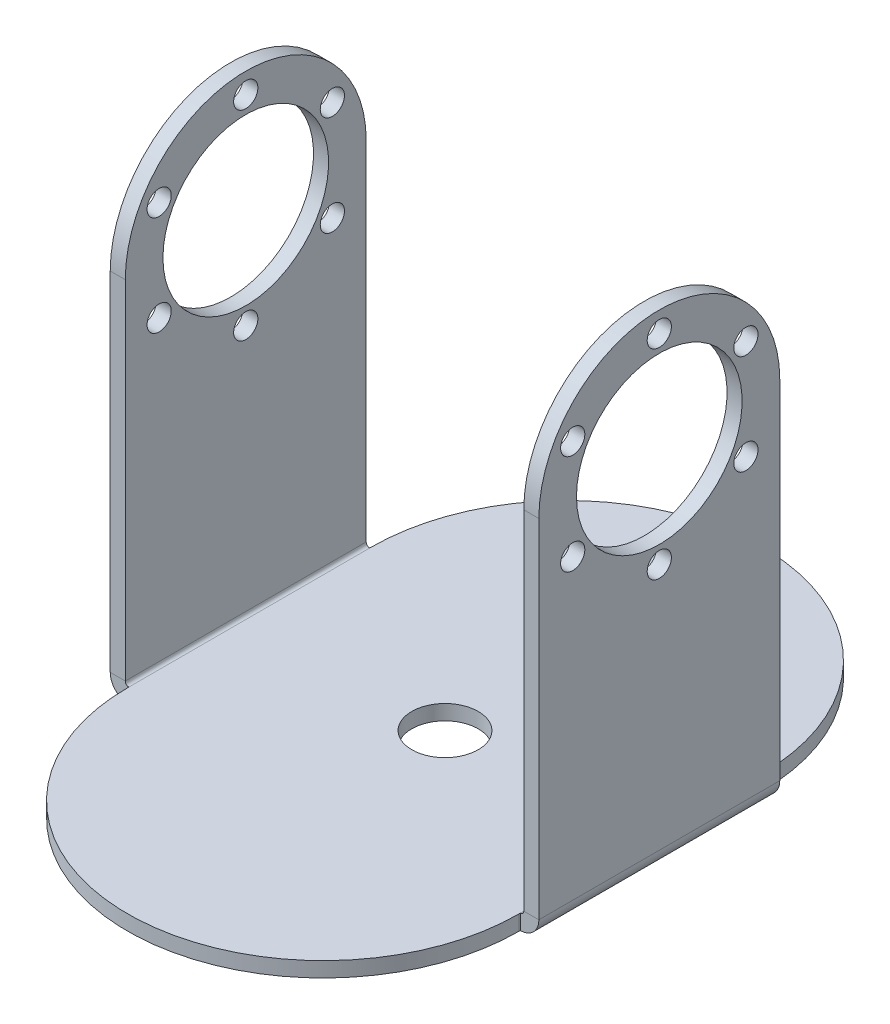
from build123d import *

# Parameters (mm, degrees)
BOSS_EXTRUDE1_DEPTH             = 3.175
SKETCH2_R                       = 17.4625
CUT_EXTRUDE1_DEPTH              = 171.897583858
F_10_CLEARANCE_HOLE1_AT_2_COUNT = 2
F_10_CLEARANCE_HOLE1_AT_2_PITCH = 21.082
F_10_CLEARANCE_HOLE1_AT_3_COUNT = 2
F_10_CLEARANCE_HOLE1_AT_3_PITCH = 36.515095125
F_10_CLEARANCE_HOLE1_AT_4_COUNT = 2
F_10_CLEARANCE_HOLE1_AT_4_PITCH = 42.164
F_10_CLEARANCE_HOLE1_AT_5_COUNT = 2
F_10_CLEARANCE_HOLE1_AT_5_PITCH = 36.515095125
F_10_CLEARANCE_HOLE1_AT_6_COUNT = 2
F_10_CLEARANCE_HOLE1_AT_6_PITCH = 21.082
SKETCHED_START                  = -145
SKETCHED_BEND1_OUTLINE_W        = 3.175
SKETCHED_BEND1_OUTLINE_H        = 50.8
SKETCHED_BEND1_DEPTH            = 99.8134
SKETCHED_START_2                = 45.1866
SKETCHED_BEND1_2_OUTLINE_W      = 3.175
SKETCHED_BEND1_2_OUTLINE_H      = 50.8
SKETCHED_BEND1_2_DEPTH          = 99.8134
SKETCHED_START_3                = -44.806157784
SKETCHED_BEND1_3_OUTLINE_R      = 2.5527
SKETCHED_BEND1_3_OUTLINE_R_2    = 17.4625
SKETCHED_BEND1_3_DEPTH          = 2.794557784
SKETCHED_START_4                = 42.0116
SKETCHED_BEND1_4_OUTLINE_R      = 2.5527
SKETCHED_BEND1_4_OUTLINE_R_2    = 17.4625
SKETCHED_BEND1_4_DEPTH          = 2.794557784
SKETCHED_START_5                = -45.1866
SKETCHED_BEND1_5_OUTLINE_R      = 2.5527
SKETCHED_BEND1_5_OUTLINE_R_2    = 17.4625
SKETCHED_BEND1_5_DEPTH          = 3.9116
SKETCHED_START_6                = 41.275
SKETCHED_BEND1_6_OUTLINE_R      = 2.5527
SKETCHED_BEND1_6_OUTLINE_R_2    = 17.4625
SKETCHED_BEND1_6_DEPTH          = 3.9116
SKETCHED_START_7                = -51.054
SKETCHED_BEND1_7_DEPTH          = 50.8
SKETCH7_R                       = 7
CUT_EXTRUDE2_DEPTH              = 144.172192314


with BuildPart() as part:
    # Sketch1 → Boss-Extrude1 (new body)
    with BuildSketch(Plane(origin=(0, 0, 0), x_dir=(1, 0, 0), z_dir=(0, 1, 0))):
        with BuildLine():
            Line((-41.275, 0), (-41.275, 0.254))
            Line((-41.275, 0.254), (-118.2116, 0.254))
            ThreePointArc((-118.2116, 0.254), (-143.6116, 25.654), (-118.2116, 51.054))
            Line((-118.2116, 51.054), (-41.275, 51.054))
            Line((-41.275, 51.054), (-41.275, 51.308))
            ThreePointArc((-41.275, 51.308), (0, 92.583), (41.275, 51.308))
            Line((41.275, 51.308), (41.275, 51.054))
            Line((41.275, 51.054), (118.2116, 51.054))
            ThreePointArc((118.2116, 51.054), (143.6116, 25.654), (118.2116, 0.254))
            Line((118.2116, 0.254), (41.275, 0.254))
            Line((41.275, 0.254), (41.275, 0))
            ThreePointArc((41.275, 0), (0, -41.275), (-41.275, 0))
        make_face()
    extrude(amount=BOSS_EXTRUDE1_DEPTH)

    # Sketch2 → Cut-Extrude1 (cut, through all)
    with BuildSketch(Plane(origin=(0, 3.175, 0), x_dir=(1, 0, 0), z_dir=(0, 1, 0))):
        with Locations(Location((-118.2116, 25.654, 0), (0, 0, 270))):
            Circle(SKETCH2_R)
    cut_extrude1 = extrude(amount=-CUT_EXTRUDE1_DEPTH, mode=Mode.SUBTRACT)

    # Sketch5 → #10 Clearance Hole1 (revolve, cut)
    with BuildSketch(Plane(origin=(-97.1296, 3.175, -25.654), x_dir=(0, 0, 1), z_dir=(1, 0, 0))):
        Polygon((0, 0), (0, 39.633816902), (2.5527, 38.1), (2.5527, 0), align=None)
    f_10_clearance_hole1 = revolve(axis=Axis((-97.1296, 9.525, -25.654), (0, -1, 0)), mode=Mode.SUBTRACT)

    # #10 Clearance Hole1 at 2: #10 Clearance Hole1 ×2
    with Locations(*[Vector(-0.5000000000000003, 0, -0.8660254037844385) * (i * F_10_CLEARANCE_HOLE1_AT_2_PITCH) for i in range(1, F_10_CLEARANCE_HOLE1_AT_2_COUNT)]):
        add(f_10_clearance_hole1, mode=Mode.SUBTRACT)

    # #10 Clearance Hole1 at 3: #10 Clearance Hole1 ×2
    with Locations(*[Vector(-0.8660254037844388, 0, -0.4999999999999998) * (i * F_10_CLEARANCE_HOLE1_AT_3_PITCH) for i in range(1, F_10_CLEARANCE_HOLE1_AT_3_COUNT)]):
        add(f_10_clearance_hole1, mode=Mode.SUBTRACT)

    # #10 Clearance Hole1 at 4: #10 Clearance Hole1 ×2
    with Locations(*[(-i * F_10_CLEARANCE_HOLE1_AT_4_PITCH, 0, 0) for i in range(1, F_10_CLEARANCE_HOLE1_AT_4_COUNT)]):
        add(f_10_clearance_hole1, mode=Mode.SUBTRACT)

    # #10 Clearance Hole1 at 5: #10 Clearance Hole1 ×2
    with Locations(*[Vector(-0.8660254037844386, 0, 0.5000000000000002) * (i * F_10_CLEARANCE_HOLE1_AT_5_PITCH) for i in range(1, F_10_CLEARANCE_HOLE1_AT_5_COUNT)]):
        add(f_10_clearance_hole1, mode=Mode.SUBTRACT)

    # #10 Clearance Hole1 at 6: #10 Clearance Hole1 ×2
    with Locations(*[Vector(-0.5000000000000003, 0, 0.8660254037844385) * (i * F_10_CLEARANCE_HOLE1_AT_6_PITCH) for i in range(1, F_10_CLEARANCE_HOLE1_AT_6_COUNT)]):
        add(f_10_clearance_hole1, mode=Mode.SUBTRACT)

    # Mirror1: Cut-Extrude1, #10 Clearance Hole1 across plane
    add(cut_extrude1.mirror(Plane(origin=(0, 0, 0), x_dir=(0, 0, 1), z_dir=(1, 0, 0))), mode=Mode.SUBTRACT)
    add(f_10_clearance_hole1.mirror(Plane(origin=(0, 0, 0), x_dir=(0, 0, 1), z_dir=(1, 0, 0))), mode=Mode.SUBTRACT)

    # Mirror1 copy 1 sketch → Mirror1 copy 1 (revolve, cut)
    with BuildSketch(Plane(origin=(107.6706, 3.175, -43.911547563), x_dir=(0, 0, 1), z_dir=(-1, 0, 0))):
        Polygon((0, 0), (0, -39.633816902), (2.5527, -38.1), (2.5527, 0), align=None)
    revolve(axis=Axis((107.6706, 9.525, -43.911547563), (0, 1, 0)), mode=Mode.SUBTRACT)

    # Mirror1 copy 2 sketch → Mirror1 copy 2 (revolve, cut)
    with BuildSketch(Plane(origin=(128.7526, 3.175, -43.911547563), x_dir=(0, 0, 1), z_dir=(-1, 0, 0))):
        Polygon((0, 0), (0, -39.633816902), (2.5527, -38.1), (2.5527, 0), align=None)
    revolve(axis=Axis((128.7526, 9.525, -43.911547563), (0, 1, 0)), mode=Mode.SUBTRACT)

    # Mirror1 copy 3 sketch → Mirror1 copy 3 (revolve, cut)
    with BuildSketch(Plane(origin=(139.2936, 3.175, -25.654), x_dir=(0, 0, 1), z_dir=(-1, 0, 0))):
        Polygon((0, 0), (0, -39.633816902), (2.5527, -38.1), (2.5527, 0), align=None)
    revolve(axis=Axis((139.2936, 9.525, -25.654), (0, 1, 0)), mode=Mode.SUBTRACT)

    # Mirror1 copy 4 sketch → Mirror1 copy 4 (revolve, cut)
    with BuildSketch(Plane(origin=(128.7526, 3.175, -7.396452437), x_dir=(0, 0, 1), z_dir=(-1, 0, 0))):
        Polygon((0, 0), (0, -39.633816902), (2.5527, -38.1), (2.5527, 0), align=None)
    revolve(axis=Axis((128.7526, 9.525, -7.396452437), (0, 1, 0)), mode=Mode.SUBTRACT)

    # Mirror1 copy 5 sketch → Mirror1 copy 5 (revolve, cut)
    with BuildSketch(Plane(origin=(107.6706, 3.175, -7.396452437), x_dir=(0, 0, 1), z_dir=(-1, 0, 0))):
        Polygon((0, 0), (0, -39.633816902), (2.5527, -38.1), (2.5527, 0), align=None)
    revolve(axis=Axis((107.6706, 9.525, -7.396452437), (0, 1, 0)), mode=Mode.SUBTRACT)

    # Sketched Bend1: read off the stored shape, not the designer's step
    # Sketched Bend1 outline → Sketched Bend1 (cut)
    with BuildSketch(Plane.YZ.offset(SKETCHED_START)):
        with Locations((1.5875, -25.654)):
            Rectangle(SKETCHED_BEND1_OUTLINE_W, SKETCHED_BEND1_OUTLINE_H)
    extrude(amount=SKETCHED_BEND1_DEPTH, mode=Mode.SUBTRACT)

    # Sketched Bend1 2 outline → Sketched Bend1 2 (cut)
    with BuildSketch(Plane.YZ.offset(SKETCHED_START_2)):
        with Locations((1.5875, -25.654)):
            Rectangle(SKETCHED_BEND1_2_OUTLINE_W, SKETCHED_BEND1_2_OUTLINE_H)
    extrude(amount=SKETCHED_BEND1_2_DEPTH, mode=Mode.SUBTRACT)

    # Sketched Bend1 3 outline → Sketched Bend1 3 (add)
    with BuildSketch(Plane.YZ.offset(SKETCHED_START_3)):
        with BuildLine():
            Line((77.197512257, -0.254), (3.175, -0.254))
            Line((3.175, -0.254), (3.175, -51.054))
            Line((3.175, -51.054), (77.197512257, -51.054))
            ThreePointArc((77.197512257, -51.054), (102.597512257, -25.654), (77.197512257, -0.254))
        make_face()
        with Locations((66.656512257, -43.911547563)):
            Circle(SKETCHED_BEND1_3_OUTLINE_R, mode=Mode.SUBTRACT)
        with Locations((87.738512257, -43.911547563)):
            Circle(SKETCHED_BEND1_3_OUTLINE_R, mode=Mode.SUBTRACT)
        with Locations((56.115512257, -25.654)):
            Circle(SKETCHED_BEND1_3_OUTLINE_R, mode=Mode.SUBTRACT)
        with Locations((77.197512257, -25.654)):
            Circle(SKETCHED_BEND1_3_OUTLINE_R_2, mode=Mode.SUBTRACT)
        with Locations((98.279512257, -25.654)):
            Circle(SKETCHED_BEND1_3_OUTLINE_R, mode=Mode.SUBTRACT)
        with Locations((66.656512257, -7.396452437)):
            Circle(SKETCHED_BEND1_3_OUTLINE_R, mode=Mode.SUBTRACT)
        with Locations((87.738512257, -7.396452437)):
            Circle(SKETCHED_BEND1_3_OUTLINE_R, mode=Mode.SUBTRACT)
    extrude(amount=SKETCHED_BEND1_3_DEPTH)

    # Sketched Bend1 4 outline → Sketched Bend1 4 (add)
    with BuildSketch(Plane.YZ.offset(SKETCHED_START_4)):
        with BuildLine():
            Line((77.197512257, -0.254), (3.175, -0.254))
            Line((3.175, -0.254), (3.175, -51.054))
            Line((3.175, -51.054), (77.197512257, -51.054))
            ThreePointArc((77.197512257, -51.054), (102.597512257, -25.654), (77.197512257, -0.254))
        make_face()
        with Locations((66.656512257, -43.911547563)):
            Circle(SKETCHED_BEND1_4_OUTLINE_R, mode=Mode.SUBTRACT)
        with Locations((87.738512257, -43.911547563)):
            Circle(SKETCHED_BEND1_4_OUTLINE_R, mode=Mode.SUBTRACT)
        with Locations((56.115512257, -25.654)):
            Circle(SKETCHED_BEND1_4_OUTLINE_R, mode=Mode.SUBTRACT)
        with Locations((77.197512257, -25.654)):
            Circle(SKETCHED_BEND1_4_OUTLINE_R_2, mode=Mode.SUBTRACT)
        with Locations((98.279512257, -25.654)):
            Circle(SKETCHED_BEND1_4_OUTLINE_R, mode=Mode.SUBTRACT)
        with Locations((66.656512257, -7.396452437)):
            Circle(SKETCHED_BEND1_4_OUTLINE_R, mode=Mode.SUBTRACT)
        with Locations((87.738512257, -7.396452437)):
            Circle(SKETCHED_BEND1_4_OUTLINE_R, mode=Mode.SUBTRACT)
    extrude(amount=SKETCHED_BEND1_4_DEPTH)

    # Sketched Bend1 5 outline → Sketched Bend1 5 (add)
    with BuildSketch(Plane.YZ.offset(SKETCHED_START_5)):
        with BuildLine():
            Line((77.197512257, -0.254), (3.175, -0.254))
            Line((3.175, -0.254), (3.175, -51.054))
            Line((3.175, -51.054), (77.197512257, -51.054))
            ThreePointArc((77.197512257, -51.054), (102.597512257, -25.654), (77.197512257, -0.254))
        make_face()
        with Locations((66.656512257, -43.911547563)):
            Circle(SKETCHED_BEND1_5_OUTLINE_R, mode=Mode.SUBTRACT)
        with Locations((87.738512257, -43.911547563)):
            Circle(SKETCHED_BEND1_5_OUTLINE_R, mode=Mode.SUBTRACT)
        with Locations((56.115512257, -25.654)):
            Circle(SKETCHED_BEND1_5_OUTLINE_R, mode=Mode.SUBTRACT)
        with Locations((77.197512257, -25.654)):
            Circle(SKETCHED_BEND1_5_OUTLINE_R_2, mode=Mode.SUBTRACT)
        with Locations((98.279512257, -25.654)):
            Circle(SKETCHED_BEND1_5_OUTLINE_R, mode=Mode.SUBTRACT)
        with Locations((66.656512257, -7.396452437)):
            Circle(SKETCHED_BEND1_5_OUTLINE_R, mode=Mode.SUBTRACT)
        with Locations((87.738512257, -7.396452437)):
            Circle(SKETCHED_BEND1_5_OUTLINE_R, mode=Mode.SUBTRACT)
    extrude(amount=SKETCHED_BEND1_5_DEPTH)

    # Sketched Bend1 6 outline → Sketched Bend1 6 (add)
    with BuildSketch(Plane.YZ.offset(SKETCHED_START_6)):
        with BuildLine():
            Line((77.197512257, -0.254), (3.175, -0.254))
            Line((3.175, -0.254), (3.175, -51.054))
            Line((3.175, -51.054), (77.197512257, -51.054))
            ThreePointArc((77.197512257, -51.054), (102.597512257, -25.654), (77.197512257, -0.254))
        make_face()
        with Locations((66.656512257, -43.911547563)):
            Circle(SKETCHED_BEND1_6_OUTLINE_R, mode=Mode.SUBTRACT)
        with Locations((87.738512257, -43.911547563)):
            Circle(SKETCHED_BEND1_6_OUTLINE_R, mode=Mode.SUBTRACT)
        with Locations((56.115512257, -25.654)):
            Circle(SKETCHED_BEND1_6_OUTLINE_R, mode=Mode.SUBTRACT)
        with Locations((77.197512257, -25.654)):
            Circle(SKETCHED_BEND1_6_OUTLINE_R_2, mode=Mode.SUBTRACT)
        with Locations((98.279512257, -25.654)):
            Circle(SKETCHED_BEND1_6_OUTLINE_R, mode=Mode.SUBTRACT)
        with Locations((66.656512257, -7.396452437)):
            Circle(SKETCHED_BEND1_6_OUTLINE_R, mode=Mode.SUBTRACT)
        with Locations((87.738512257, -7.396452437)):
            Circle(SKETCHED_BEND1_6_OUTLINE_R, mode=Mode.SUBTRACT)
    extrude(amount=SKETCHED_BEND1_6_DEPTH)

    # Sketched Bend1 7 outline → Sketched Bend1 7 (cut)
    with BuildSketch(Plane.XY.offset(SKETCHED_START_7)):
        with BuildLine():
            Line((-42.0116, 104), (-42.0116, 3.9116))
            ThreePointArc((-42.0116, 3.9116), (-41.795854855, 3.390745145), (-41.275, 3.175))
            Line((-41.275, 3.175), (-41.275, 104))
            Line((-41.275, 104), (-42.0116, 104))
        make_face()
        with BuildLine():
            Line((-45.1866, 3.9116), (-45.186600025, 104))
            Line((-45.186600025, 104), (-47, 104))
            Line((-47, 104), (-47, -2.2e-08))
            Line((-47, -2.2e-08), (-41.275, 0))
            ThreePointArc((-41.275, 0), (-44.040918885, 1.145681115), (-45.1866, 3.9116))
        make_face()
        with BuildLine():
            Line((42.0116, 104), (41.275, 104))
            Line((41.275, 104), (41.275, 3.175))
            ThreePointArc((41.275, 3.175), (41.795854855, 3.390745145), (42.0116, 3.9116))
            Line((42.0116, 3.9116), (42.0116, 104))
        make_face()
        with BuildLine():
            Line((47, 104), (45.186600025, 104))
            Line((45.186600025, 104), (45.1866, 3.9116))
            ThreePointArc((45.1866, 3.9116), (44.040918885, 1.145681115), (41.275, 0))
            Line((41.275, 0), (47, -2.2e-08))
            Line((47, -2.2e-08), (47, 104))
        make_face()
    extrude(amount=SKETCHED_BEND1_7_DEPTH, mode=Mode.SUBTRACT)

    # Sketch7 → Cut-Extrude2 (cut, through all)
    with BuildSketch(Plane(origin=(0, 3.175, 0), x_dir=(1, 0, 0), z_dir=(0, 1, 0))):
        with Locations(Location((0, 25.654, 0), (0, 0, 270))):
            Circle(SKETCH7_R)
    extrude(amount=-CUT_EXTRUDE2_DEPTH, mode=Mode.SUBTRACT)


solid = part.part
